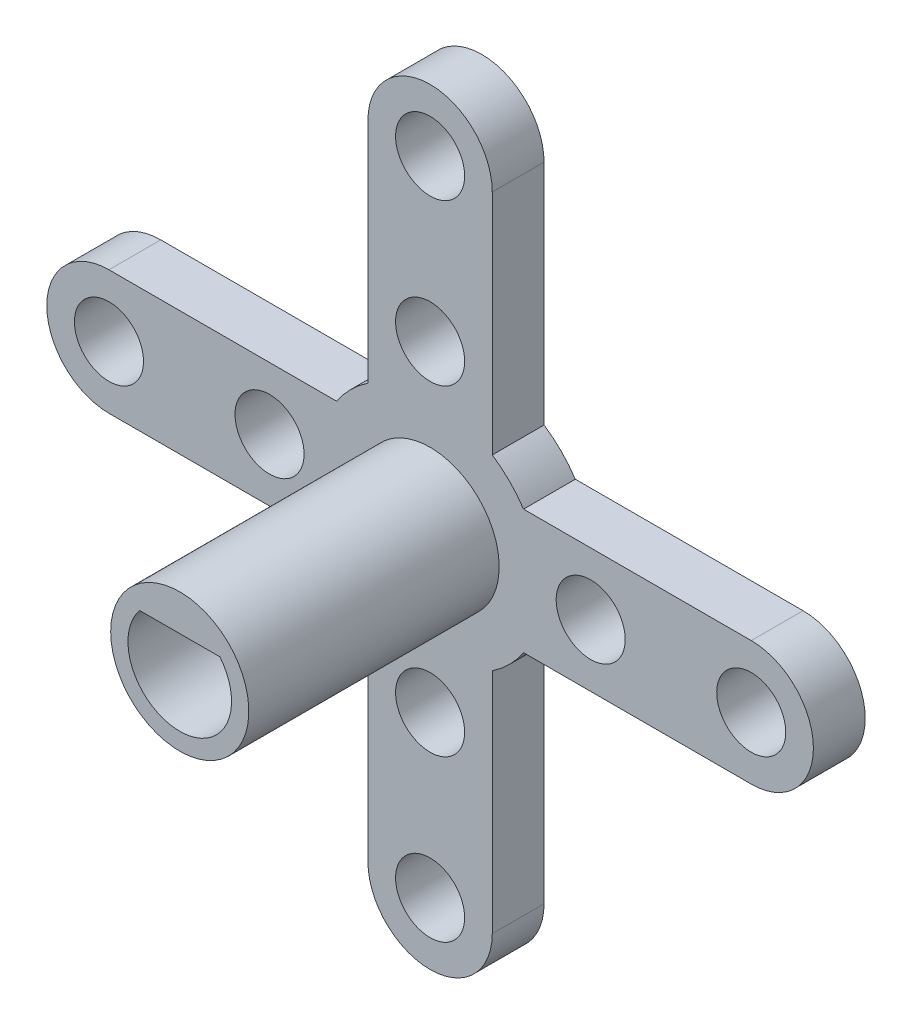
from build123d import *

# Parameters (mm, degrees)
SKETCH1_R           = 1
BOSS_EXTRUDE1_DEPTH = 1.5
CIRPATTERN1_COUNT   = 4
SKETCH3_R           = 2
BOSS_EXTRUDE3_DEPTH = 7.25


with BuildPart() as part:
    # Sketch1 → Boss-Extrude1 (new body)
    with BuildSketch(Plane.XY):
        with BuildLine():
            Line((1.8, 2.706011826), (1.8, 9.3))
            ThreePointArc((1.8, 9.3), (0, 11.1), (-1.8, 9.3))
            Line((-1.8, 9.3), (-1.8, 2.706011826))
            ThreePointArc((-1.8, 2.706011826), (0, -3.25), (1.8, 2.706011826))
        make_face()
        with Locations((0, 4.65)):
            Circle(SKETCH1_R, mode=Mode.SUBTRACT)
        with Locations((0, 9.3)):
            Circle(SKETCH1_R, mode=Mode.SUBTRACT)
    boss_extrude1 = extrude(amount=BOSS_EXTRUDE1_DEPTH)

    # CirPattern1: Boss-Extrude1 ×4 about axis
    cirpattern1_axis = Axis((0, 0, 1.5), (0, 0, 1))
    for i in range(1, CIRPATTERN1_COUNT):
        add(boss_extrude1.rotate(cirpattern1_axis, i * 360 / CIRPATTERN1_COUNT))

    # Sketch3 → Boss-Extrude3 (add)
    with BuildSketch(Plane.XY.offset(1.5)):
        Circle(SKETCH3_R)
        with BuildLine():
            Line((-1.160818677, 0.95), (1.160818677, 0.95))
            ThreePointArc((1.160818677, 0.95), (0, -1.5), (-1.160818677, 0.95))
        make_face(mode=Mode.SUBTRACT)
    extrude(amount=BOSS_EXTRUDE3_DEPTH)


solid = part.part
